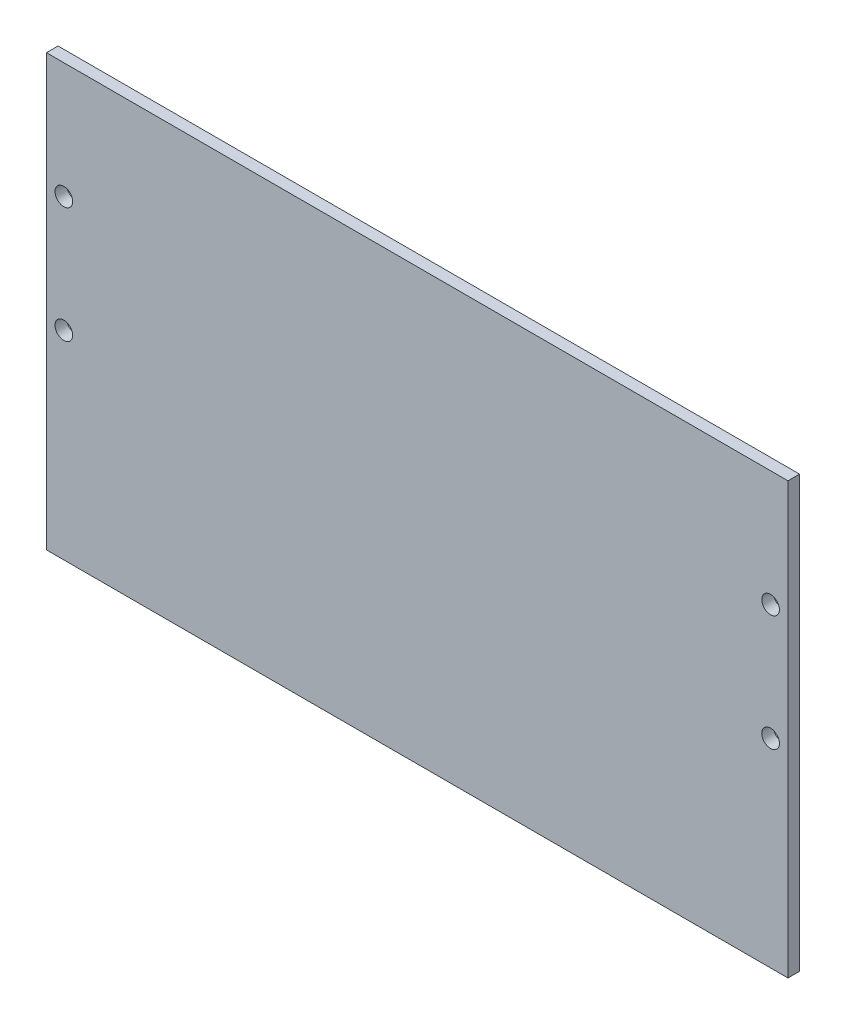
from build123d import *

# Parameters (mm, degrees)
SKETCH_1_W      = 128
SKETCH_1_H      = 74.330343737
SKETCH_1_R      = 1.525
EXTRUDE_1_DEPTH = 2


with BuildPart() as part:
    # 草图1 → 凸台-拉伸1 (new body)
    with BuildSketch(Plane.XY):
        with Locations((64, 37.165171869)):
            Rectangle(SKETCH_1_W, SKETCH_1_H)
        with Locations((3, 54.330343737)):
            Circle(SKETCH_1_R, mode=Mode.SUBTRACT)
        with Locations((3, 34.330343737)):
            Circle(SKETCH_1_R, mode=Mode.SUBTRACT)
        with Locations((125, 34.330343737)):
            Circle(SKETCH_1_R, mode=Mode.SUBTRACT)
        with Locations((125, 54.330343737)):
            Circle(SKETCH_1_R, mode=Mode.SUBTRACT)
    extrude(amount=EXTRUDE_1_DEPTH)


solid = part.part
